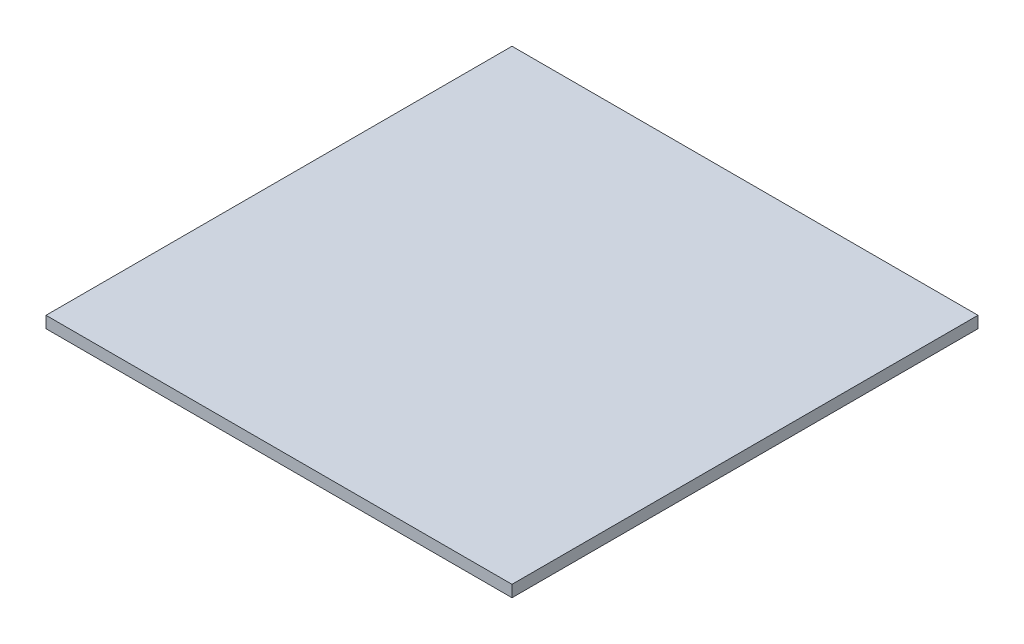
from build123d import *

# Parameters (mm, degrees)
SKETCH1_W           = 120
SKETCH1_H           = 120
BOSS_EXTRUDE1_DEPTH = 3


with BuildPart() as part:
    # Sketch1 → Boss-Extrude1 (new body)
    with BuildSketch(Plane(origin=(0, 0, 0), x_dir=(1, 0, 0), z_dir=(0, 1, 0))):
        Rectangle(SKETCH1_W, SKETCH1_H)
    extrude(amount=BOSS_EXTRUDE1_DEPTH)


solid = part.part
